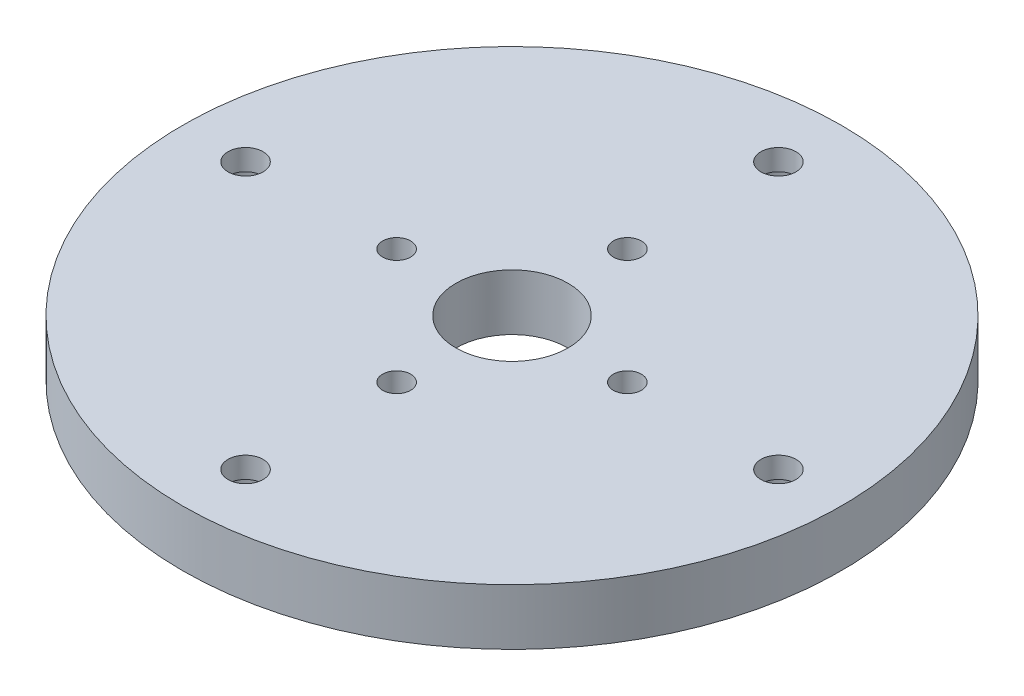
from build123d import *

# Parameters (mm, degrees)
SKETCH1_R           = 23.5
BOSS_EXTRUDE1_DEPTH = 4
SKETCH2_R           = 1
SKETCH2_R_2         = 1.25
CUT_EXTRUDE1_DEPTH  = 34.473870407
CUT_EXTRUDE2_REACH  = 35.474
SKETCH3_R           = 4
SKETCH4_R           = 2.5
CUT_EXTRUDE3_DEPTH  = 2.5


with BuildPart() as part:
    # Sketch1 → Boss-Extrude1 (new body)
    with BuildSketch(Plane(origin=(0, 0, 0), x_dir=(1, 0, 0), z_dir=(0, 1, 0))):
        Circle(SKETCH1_R)
    extrude(amount=BOSS_EXTRUDE1_DEPTH)

    # Sketch2 → Cut-Extrude1 (cut, through all)
    with BuildSketch(Plane(origin=(0, 4, 0), x_dir=(1, 0, 0), z_dir=(0, 1, 0))):
        with Locations((0, 8.227062517)):
            Circle(SKETCH2_R)
        with Locations((8.227062517, 0)):
            Circle(SKETCH2_R)
        with Locations((0, -8.227062517)):
            Circle(SKETCH2_R)
        with Locations((-8.227062517, 0)):
            Circle(SKETCH2_R)
        with Locations((0, 19)):
            Circle(SKETCH2_R_2)
        with Locations((19, 0)):
            Circle(SKETCH2_R_2)
        with Locations((0, -19)):
            Circle(SKETCH2_R_2)
        with Locations((-19, 0)):
            Circle(SKETCH2_R_2)
    extrude(amount=-CUT_EXTRUDE1_DEPTH, mode=Mode.SUBTRACT)

    # Sketch3 → Cut-Extrude2 (cut, up to next)
    with BuildSketch(Plane.XZ, mode=Mode.PRIVATE) as cut_extrude2_sk1:
        Circle(SKETCH3_R)
    cut_extrude2_tool1 = extrude(cut_extrude2_sk1.sketch, amount=-CUT_EXTRUDE2_REACH, mode=Mode.PRIVATE) & part.part
    add(cut_extrude2_tool1.solids().sort_by_distance((0, 0, 0))[0], mode=Mode.SUBTRACT)

    # Sketch4 → Cut-Extrude3 (cut)
    with BuildSketch(Plane.XZ):
        with Locations((0, 19)):
            Circle(SKETCH4_R)
        with Locations((19, 0)):
            Circle(SKETCH4_R)
        with Locations((0, -19)):
            Circle(SKETCH4_R)
        with Locations((-19, 0)):
            Circle(SKETCH4_R)
    extrude(amount=-CUT_EXTRUDE3_DEPTH, mode=Mode.SUBTRACT)


solid = part.part
